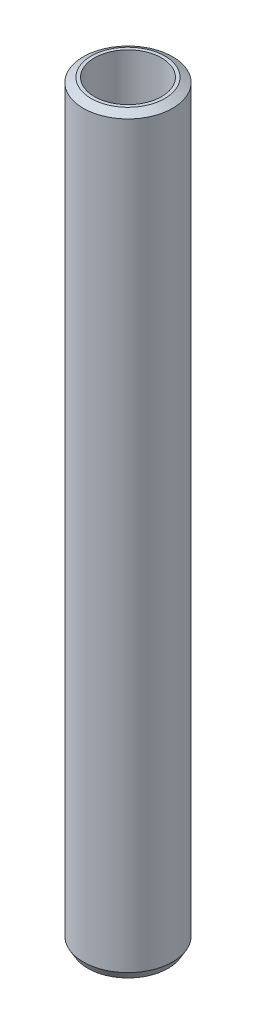
from build123d import *
from OCP.BRepFilletAPI import BRepFilletAPI_MakeChamfer

# Parameters (mm, degrees)
SKETCH1_R           = 35
BOSS_EXTRUDE1_DEPTH = 588.745721891
SKETCH2_R           = 26.305288011
CUT_EXTRUDE1_DEPTH  = 591.822752646
CHAMFER1_SIZE       = 3.551550972
CHAMFER1_SIZE2      = 6.151466729


with BuildPart() as part:
    # Sketch1 → Boss-Extrude1 (new body)
    with BuildSketch(Plane(origin=(0, 0, 0), x_dir=(1, 0, 0), z_dir=(0, 1, 0))):
        Circle(SKETCH1_R)
    extrude(amount=BOSS_EXTRUDE1_DEPTH)

    # Sketch2 → Cut-Extrude1 (cut, through all)
    with BuildSketch(Plane(origin=(0, 0, 0), x_dir=(1, 0, 0), z_dir=(0, 1, 0))):
        Circle(SKETCH2_R)
    extrude(amount=CUT_EXTRUDE1_DEPTH, mode=Mode.SUBTRACT)

    # Chamfer1: one chamfer whose edges measure the first distance from different faces: ONE call of the kernel's chamfer builder (chamfer() names one face for all edges)
    chamfer1_edges_1 = [part.edges().sort_by_distance(p)[0] for p in [
        (-35, 588.745721891, 0),
    ]]
    chamfer1_side_1 = [part.faces().sort_by_distance(p)[0] for p in [
        (-35, 294.372860945, 0),
    ]]
    chamfer1_edges_2 = [part.edges().sort_by_distance(p)[0] for p in [
        (-35, 0, 0),
    ]]
    chamfer1_side_2 = [part.faces().sort_by_distance(p)[0] for p in [
        (-34.010050506, 0, 0),
    ]]
    chamfer1 = BRepFilletAPI_MakeChamfer(part.part.solid().wrapped)
    for e in chamfer1_edges_1:
        chamfer1.Add(CHAMFER1_SIZE, CHAMFER1_SIZE2, e.wrapped, chamfer1_side_1[0].wrapped)  # the first distance lies on this face
    for e in chamfer1_edges_2:
        chamfer1.Add(CHAMFER1_SIZE, CHAMFER1_SIZE2, e.wrapped, chamfer1_side_2[0].wrapped)  # the first distance lies on this face
    add(Compound.cast(chamfer1.Shape()), mode=Mode.REPLACE)


solid = part.part
